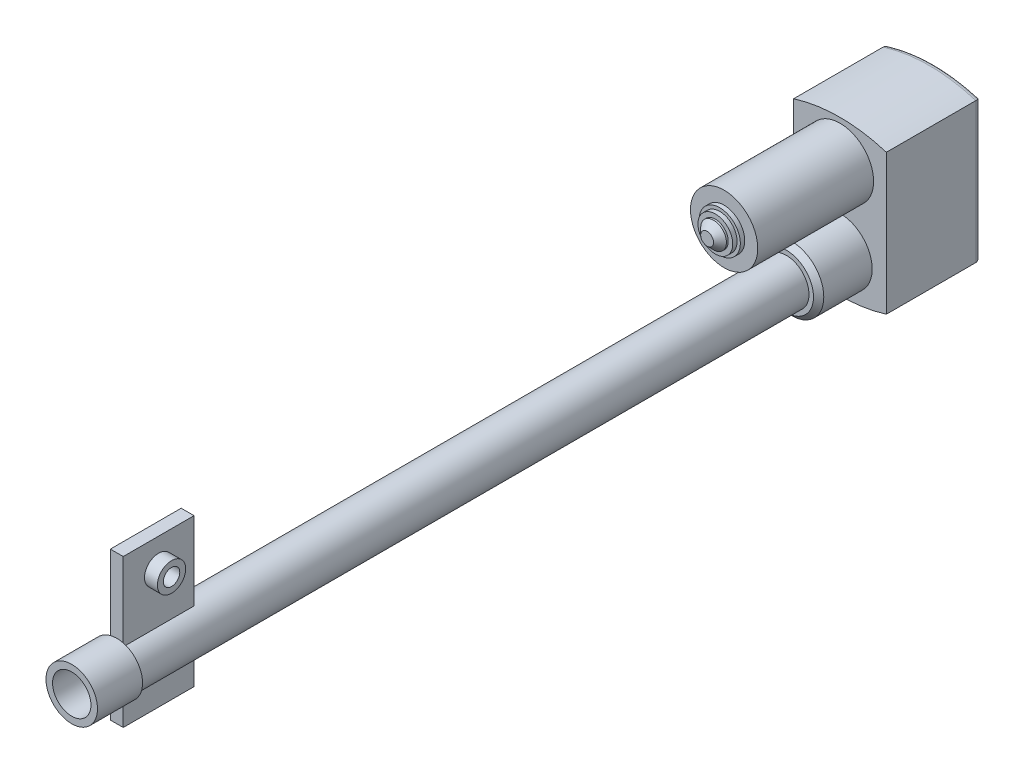
from build123d import *

# Parameters (mm, degrees)
CROQUIS1_W                    = 73.5
CROQUIS1_H                    = 120
SALIENTE_EXTRUIR1_DEPTH       = 72
CROQUIS2_R                    = 26.1
SALIENTE_EXTRUIR2_DEPTH       = 90
CROQUIS3_R                    = 16
SALIENTE_EXTRUIR3_DEPTH       = 3.4
CROQUIS4_R                    = 13.5
SALIENTE_EXTRUIR4_DEPTH       = 3.4
CROQUIS5_R                    = 10
SALIENTE_EXTRUIR5_DEPTH       = 6.4
CHAFL_N1_SIZE                 = 5
CROQUIS6_R                    = 25
SALIENTE_EXTRUIR6_DEPTH       = 41.6
CROQUIS7_R                    = 17.5
SALIENTE_EXTRUIR7_DEPTH       = 520
CHAFL_N2_SIZE                 = 4
CROQUIS8_R                    = 20
SALIENTE_EXTRUIR8_DEPTH       = 35
SALIENTE_EXTRUIR11_DEPTH      = 5
SALIENTE_EXTRUIR11_DEPTH_BACK = 5
CROQUIS11_W                   = 55
CROQUIS11_H                   = 115
CROQUIS9_R                    = 14.9
CORTAR_EXTRUIR1_DEPTH         = 450
SALIENTE_EXTRUIR12_DEPTH      = 10
SALIENTE_EXTRUIR12_DEPTH_BACK = 20
CROQUIS12_R                   = 11
CROQUIS13_R                   = 6.4
CORTAR_EXTRUIR2_DEPTH         = 30
CORTAR_EXTRUIR4_DEPTH         = 91
REDONDEO1_R                   = 4


with BuildPart() as part:
    # Croquis1 → Saliente-Extruir1 (new body)
    with BuildSketch(Plane(origin=(0, 0, 0), x_dir=(0, 0, -1), z_dir=(1, 0, 0))):
        Rectangle(CROQUIS1_W, CROQUIS1_H)
    extrude(amount=SALIENTE_EXTRUIR1_DEPTH)

    # Croquis2 → Saliente-Extruir2 (add)
    with BuildSketch(Plane.XY.offset(36.75)):
        with Locations((36, 29.9)):
            Circle(CROQUIS2_R)
    extrude(amount=SALIENTE_EXTRUIR2_DEPTH)

    # Croquis3 → Saliente-Extruir3 (add)
    with BuildSketch(Plane.XY.offset(126.75)):
        with Locations((36, 29.9)):
            Circle(CROQUIS3_R)
    extrude(amount=SALIENTE_EXTRUIR3_DEPTH)

    # Croquis4 → Saliente-Extruir4 (add)
    with BuildSketch(Plane.XY.offset(130.15)):
        with Locations((36, 29.9)):
            Circle(CROQUIS4_R)
    extrude(amount=SALIENTE_EXTRUIR4_DEPTH)

    # Croquis5 → Saliente-Extruir5 (add)
    with BuildSketch(Plane.XY.offset(133.55)):
        with Locations((36, 29.9)):
            Circle(CROQUIS5_R)
    extrude(amount=SALIENTE_EXTRUIR5_DEPTH)

    # Chaflán1
    chafl_n1_edges = [part.edges().sort_by_distance(p)[0] for p in [
        (26, 29.9, 139.95),
    ]]
    chamfer(chafl_n1_edges, length=CHAFL_N1_SIZE)

    # Croquis6 → Saliente-Extruir6 (add)
    with BuildSketch(Plane.XY.offset(36.75)):
        with Locations((36, -29.6)):
            Circle(CROQUIS6_R)
    extrude(amount=SALIENTE_EXTRUIR6_DEPTH)

    # Croquis7 → Saliente-Extruir7 (add)
    with BuildSketch(Plane.XY.offset(78.35)):
        with Locations((36, -29.6)):
            Circle(CROQUIS7_R)
    extrude(amount=SALIENTE_EXTRUIR7_DEPTH)

    # Chaflán2
    chafl_n2_edges = [part.edges().sort_by_distance(p)[0] for p in [
        (11, -29.6, 78.35),
    ]]
    chamfer(chafl_n2_edges, length=CHAFL_N2_SIZE)

    # Croquis8 → Saliente-Extruir8 (add)
    with BuildSketch(Plane.XY.offset(598.35)):
        with Locations((36, -29.6)):
            Circle(CROQUIS8_R)
    extrude(amount=SALIENTE_EXTRUIR8_DEPTH)

    # Croquis11 → Saliente-Extruir11 (add, two sides: drawn at the far end of the back side and taken through both)
    with BuildSketch(Plane(origin=(36, 0, 0), x_dir=(0, 0, -1), z_dir=(1, 0, 0)).offset(-SALIENTE_EXTRUIR11_DEPTH_BACK)):
        with Locations((-570.85, -9.6)):
            Rectangle(CROQUIS11_W, CROQUIS11_H)
    extrude(amount=SALIENTE_EXTRUIR11_DEPTH + SALIENTE_EXTRUIR11_DEPTH_BACK)

    # Croquis9 → Cortar-Extruir1 (cut)
    with BuildSketch(Plane.XY.offset(633.35)):
        with Locations((36, -29.6)):
            Circle(CROQUIS9_R)
    extrude(amount=-CORTAR_EXTRUIR1_DEPTH, mode=Mode.SUBTRACT)

    # Croquis12 → Saliente-Extruir12 (add, two sides: drawn at the far end of the back side and taken through both)
    with BuildSketch(Plane(origin=(41, 0, 0), x_dir=(0, 0, -1), z_dir=(1, 0, 0)).offset(-SALIENTE_EXTRUIR12_DEPTH_BACK)):
        with Locations((-570.85, 25.4)):
            Circle(CROQUIS12_R)
    extrude(amount=SALIENTE_EXTRUIR12_DEPTH + SALIENTE_EXTRUIR12_DEPTH_BACK)

    # Croquis13 → Cortar-Extruir2 (cut)
    with BuildSketch(Plane(origin=(51, 0, 0), x_dir=(0, 0, -1), z_dir=(1, 0, 0))):
        with Locations((-570.85, 25.4)):
            Circle(CROQUIS13_R)
    extrude(amount=-CORTAR_EXTRUIR2_DEPTH, mode=Mode.SUBTRACT)

    # Croquis14 → Cortar-Extruir4 (cut)
    with BuildSketch(Plane(origin=(0, 0, -36.75), x_dir=(-1, 0, 0), z_dir=(0, 0, -1))):
        with BuildLine():
            ThreePointArc((-36, 60), (-17.789076086, 58.610127098), (0, 54.47270417))
            Line((0, 54.47270417), (0, 60))
            Line((0, 60), (-36, 60))
        make_face()
        with BuildLine():
            Line((0, -60), (0, -54.47270417))
            ThreePointArc((0, -54.47270417), (-17.789076086, -58.610127098), (-36, -60))
            Line((-36, -60), (0, -60))
        make_face()
        with BuildLine():
            Line((-72, 60), (-72, 54.47270417))
            ThreePointArc((-72, 54.47270417), (-54.210923914, 58.610127098), (-36, 60))
            Line((-36, 60), (-72, 60))
        make_face()
        with BuildLine():
            ThreePointArc((-36, -60), (-54.210923914, -58.610127098), (-72, -54.47270417))
            Line((-72, -54.47270417), (-72, -60))
            Line((-72, -60), (-36, -60))
        make_face()
    extrude(amount=-CORTAR_EXTRUIR4_DEPTH, mode=Mode.SUBTRACT)

    # Redondeo1
    redondeo1_edges = [part.edges().sort_by_distance(p)[0] for p in [
        (0, 0, -36.75),
        (36, -60, -36.75),
        (72, 0, -36.75),
        (36, 60, -36.75),
    ]]
    fillet(redondeo1_edges, radius=REDONDEO1_R)


solid = part.part
